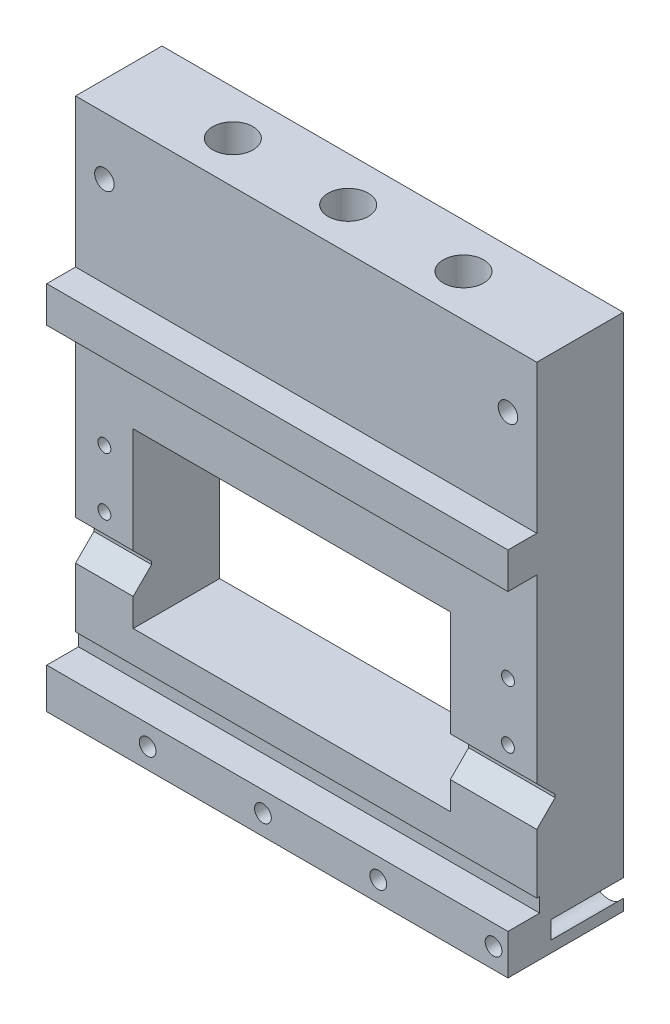
from build123d import *

# Parameters (mm, degrees)
SKETCH1_W              = 160
SKETCH1_H              = 180
SKETCH1_W_2            = 110
SKETCH1_H_2            = 60
BOSS_EXTRUDE1_DEPTH    = 30
SKETCH2_W              = 1
SKETCH2_H              = 5
CUT_EXTRUDE1_DEPTH     = 300
SKETCH11_W             = 160
SKETCH11_H             = 14
SKETCH11_H_2           = 12.5
BOSS_EXTRUDE2_DEPTH    = 10
SKETCH3_R              = 3
CUT_EXTRUDE2_DEPTH     = 100
SKETCH4_R              = 7
CUT_EXTRUDE3_DEPTH     = 70
LPATTERN1_COUNT        = 3
LPATTERN1_PITCH        = 40
SKETCH5_R              = 2.238650571
CUT_EXTRUDE4_DEPTH     = 100
SKETCH6_R              = 4.368973
CUT_EXTRUDE5_DEPTH     = 25
LPATTERN2_COUNT        = 2
LPATTERN2_PITCH        = 20
LPATTERN2_COUNT_DIR2   = 2
LPATTERN2_PITCH_DIR2   = 140
SKETCH9_R              = 3.381759822
CUT_EXTRUDE8_DEPTH     = 100
CUT_EXTRUDE9_START     = -10
SKETCH10_R             = 6.982534733
CUT_EXTRUDE9_DEPTH     = 20
LPATTERN4_COUNT        = 2
LPATTERN4_PITCH        = 140
SKETCH7_R              = 2.900161541
CUT_EXTRUDE6_DEPTH     = 40
SKETCH8_R              = 5.870976625
CUT_EXTRUDE7_DEPTH     = 25
PATTERN_LINEAR_1_COUNT = 4
PATTERN_LINEAR_1_PITCH = 40


with BuildPart() as part:
    # Sketch1 → Boss-Extrude1 (new body)
    with BuildSketch(Plane.XY):
        with Locations((-3.103448276, 46.293103448)):
            Rectangle(SKETCH1_W, SKETCH1_H)
        with Locations((-8.103448276, 16.293103448)):
            Rectangle(SKETCH1_W_2, SKETCH1_H_2, mode=Mode.SUBTRACT)
    extrude(amount=BOSS_EXTRUDE1_DEPTH)

    # Sketch2 → Cut-Extrude1 (cut)
    with BuildSketch(Plane.ZY.offset(83.103448276)):
        Polygon((30, 9.657064479), (23.636038969, 3.293103448), (23.636038969, 2.293103448), (30, -4.070857582), align=None)
        with Locations((29.5, -27.206896552)):
            Rectangle(SKETCH2_W, SKETCH2_H)
    extrude(amount=-CUT_EXTRUDE1_DEPTH, mode=Mode.SUBTRACT)

    # Sketch11 → Boss-Extrude2 (add)
    with BuildSketch(Plane.XY.offset(30)):
        with Locations((-3.103448276, -36.706896552)):
            Rectangle(SKETCH11_W, SKETCH11_H)
        with Locations((-3.103448276, 78.643103448)):
            Rectangle(SKETCH11_W, SKETCH11_H_2)
    extrude(amount=BOSS_EXTRUDE2_DEPTH)

    # Sketch3 → Cut-Extrude2 (cut)
    with BuildSketch(Plane(origin=(0, 136.293103448, 0), x_dir=(1, 0, 0), z_dir=(0, 1, 0))):
        with Locations((-43.103448276, -15.436210525)):
            Circle(SKETCH3_R)
    cut_extrude2 = extrude(amount=-CUT_EXTRUDE2_DEPTH, mode=Mode.SUBTRACT)

    # Sketch4 → Cut-Extrude3 (cut)
    with BuildSketch(Plane(origin=(0, 136.293103448, 0), x_dir=(1, 0, 0), z_dir=(0, 1, 0))):
        with Locations((-43.103448276, -15.436210525)):
            Circle(SKETCH4_R)
    cut_extrude3 = extrude(amount=-CUT_EXTRUDE3_DEPTH, mode=Mode.SUBTRACT)

    # LPattern1: Cut-Extrude2, Cut-Extrude3 ×3
    with Locations(*[(i * LPATTERN1_PITCH, 0, 0) for i in range(1, LPATTERN1_COUNT)]):
        add(cut_extrude2, mode=Mode.SUBTRACT)
        add(cut_extrude3, mode=Mode.SUBTRACT)

    # Sketch5 → Cut-Extrude4 (cut)
    with BuildSketch(Plane(origin=(0, 0, 0), x_dir=(-1, 0, 0), z_dir=(0, 0, -1))):
        with Locations((73.103448276, 16.293103448)):
            Circle(SKETCH5_R)
    cut_extrude4 = extrude(amount=-CUT_EXTRUDE4_DEPTH, mode=Mode.SUBTRACT)

    # Sketch6 → Cut-Extrude5 (cut)
    with BuildSketch(Plane(origin=(0, 0, 0), x_dir=(-1, 0, 0), z_dir=(0, 0, -1))):
        with Locations((73.103448276, 16.293103448)):
            Circle(SKETCH6_R)
    cut_extrude5 = extrude(amount=-CUT_EXTRUDE5_DEPTH, mode=Mode.SUBTRACT)

    # LPattern2: Cut-Extrude4, Cut-Extrude5 2 × 2
    with Locations(*[(j * LPATTERN2_PITCH_DIR2, i * LPATTERN2_PITCH, 0) for i in range(LPATTERN2_COUNT) for j in range(LPATTERN2_COUNT_DIR2) if (i, j) != (0, 0)]):
        add(cut_extrude4, mode=Mode.SUBTRACT)
        add(cut_extrude5, mode=Mode.SUBTRACT)

    # Sketch9 → Cut-Extrude8 (cut)
    with BuildSketch(Plane(origin=(0, 0, 0), x_dir=(-1, 0, 0), z_dir=(0, 0, -1))):
        with Locations((-66.896551724, 116.293103448)):
            Circle(SKETCH9_R)
    cut_extrude8 = extrude(amount=-CUT_EXTRUDE8_DEPTH, mode=Mode.SUBTRACT)

    # Sketch10 → Cut-Extrude9 (cut)
    with BuildSketch(Plane.XY.offset(30).offset(CUT_EXTRUDE9_START)):
        with Locations((66.896551724, 116.293103448)):
            Circle(SKETCH10_R)
    cut_extrude9 = extrude(amount=-CUT_EXTRUDE9_DEPTH, mode=Mode.SUBTRACT)

    # LPattern4: Cut-Extrude8, Cut-Extrude9 ×2
    with Locations(*[(-i * LPATTERN4_PITCH, 0, 0) for i in range(1, LPATTERN4_COUNT)]):
        add(cut_extrude8, mode=Mode.SUBTRACT)
        add(cut_extrude9, mode=Mode.SUBTRACT)

    # Sketch7 → Cut-Extrude6 (cut)
    with BuildSketch(Plane(origin=(0, 0, 0), x_dir=(-1, 0, 0), z_dir=(0, 0, -1))):
        with Locations((48.103448276, -36.706896552)):
            Circle(SKETCH7_R)
    cut_extrude6 = extrude(amount=-CUT_EXTRUDE6_DEPTH, mode=Mode.SUBTRACT)

    # Sketch8 → Cut-Extrude7 (cut)
    with BuildSketch(Plane(origin=(0, 0, 0), x_dir=(-1, 0, 0), z_dir=(0, 0, -1))):
        with Locations((48.103448276, -36.706896552)):
            Circle(SKETCH8_R)
    cut_extrude7 = extrude(amount=-CUT_EXTRUDE7_DEPTH, mode=Mode.SUBTRACT)

    # Линейный массив1: Cut-Extrude6, Cut-Extrude7 ×4
    with Locations(*[(i * PATTERN_LINEAR_1_PITCH, 0, 0) for i in range(1, PATTERN_LINEAR_1_COUNT)]):
        add(cut_extrude6, mode=Mode.SUBTRACT)
        add(cut_extrude7, mode=Mode.SUBTRACT)


solid = part.part
